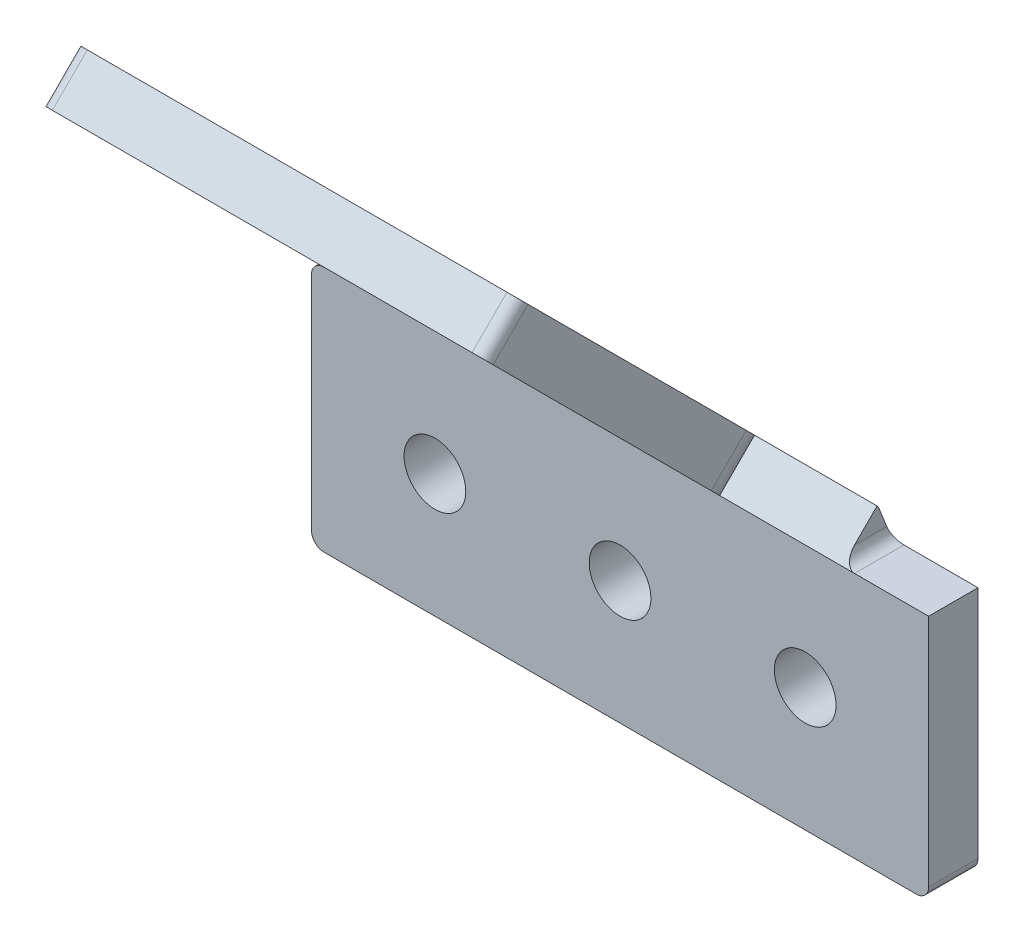
from build123d import *

# Parameters (mm, degrees)
SKETCH_1_W          = 50
SKETCH_1_H          = 20
EXTRUDE_1_DEPTH     = 4
EXTRUDE_2_DEPTH     = 18
SKETCH_5_R          = 1.5
CUT_EXTRUDE_1_DEPTH = 59.543629581
SKETCH_6_W          = 15
SKETCH_6_H          = 12
CUT_EXTRUDE_2_DEPTH = 59.543629581
FILLET_1_R          = 1
FILLET_2_R          = 1
FILLET_3_R          = 1
SKETCH_7_R          = 2.5
CUT_EXTRUDE_3_DEPTH = 2
SKETCH_8_R          = 2.5
CUT_EXTRUDE_4_DEPTH = 57.695644481
SKETCH_9_W          = 10.6
SKETCH_9_H          = 4.503957044
CUT_EXTRUDE_5_DEPTH = 10
FILLET_4_R          = 3


with BuildPart() as part:
    # 草图1 → 凸台-拉伸1 (new body)
    with BuildSketch(Plane.XY):
        Rectangle(SKETCH_1_W, SKETCH_1_H)
    extrude(amount=EXTRUDE_1_DEPTH)

    # 草图4 → 凸台-拉伸2 (add, symmetric)
    with BuildSketch(Plane(origin=(0, 0, 0), x_dir=(0, 0, -1), z_dir=(1, 0, 0))):
        Polygon((-4, 10), (-32.991378029, 38.991378029), (-30.162950904, 41.819805153), (-1.087902103, 12.744756352), (0, 10), align=None)
    extrude(amount=EXTRUDE_2_DEPTH, both=True)

    # 草图5 → 切除-拉伸1 (cut, through all)
    with BuildSketch(Plane(origin=(0, 3, -3), x_dir=(1, 0, 0), z_dir=(0, -0.7071067811865488, 0.7071067811865462))):
        with Locations(Location((12.721590614, 44.887973136, 0), (0, 0, 270))):
            Circle(SKETCH_5_R)
        with Locations(Location((-13.670456314, 14.830364134, 0), (0, 0, 270))):
            Circle(SKETCH_5_R)
    extrude(amount=-CUT_EXTRUDE_1_DEPTH, mode=Mode.SUBTRACT)

    # 草图6 → 切除-拉伸2 (cut, through all)
    with BuildSketch(Plane(origin=(0, 3, -3), x_dir=(1, 0, 0), z_dir=(0, -0.7071067811865488, 0.7071067811865462))):
        with Locations((10.5, 15.899494937)):
            Rectangle(SKETCH_6_W, SKETCH_6_H)
    extrude(amount=-CUT_EXTRUDE_2_DEPTH, mode=Mode.SUBTRACT)

    # 圆角1
    fillet_1_edges = [part.edges().sort_by_distance(p)[0] for p in [
        (3, 11.414213562, 2.585786438),
        (3, 19.899494937, 11.071067812),
    ]]
    fillet(fillet_1_edges, radius=FILLET_1_R)

    # 圆角2
    # the kernel refuses this fillet: 1 mm, written as the material it adds along each edge
    with BuildSketch(Plane(origin=(-18, 10, 0), x_dir=(0, 1, 0), z_dir=(0, 0, 1))) as fillet_2_piece_1_section:
        with BuildLine():
            CenterArc((FILLET_2_R, FILLET_2_R), FILLET_2_R, 180, 90)
            Line((0, FILLET_2_R), (0, 0))
            Line((0, 0), (FILLET_2_R, 0))
        make_face()
    fillet_2_piece_1 = extrude(amount=4, mode=Mode.PRIVATE)
    fillet_2_piece_1 = split(fillet_2_piece_1, bisect_by=Plane(origin=(-18.229103678, 9.132725648, 3.132725648), z_dir=(0, 0.7071067811865489, -0.7071067811865462)), keep=Keep.TOP, mode=Mode.PRIVATE)
    fillet_2_piece_1 = split(fillet_2_piece_1, bisect_by=Plane(origin=(-18.229103678, 10.891700331, 0.353431249), z_dir=(0, -0.36846891223412287, 0.9296400705203075)), keep=Keep.TOP, mode=Mode.PRIVATE)
    add(fillet_2_piece_1)
    with BuildSketch(Plane(origin=(-18, 10, 0), x_dir=(0, 1, 0), z_dir=(0, 0, 1))) as fillet_2_piece_2_section:
        with BuildLine():
            CenterArc((FILLET_2_R, FILLET_2_R), FILLET_2_R, 180, 90)
            Line((0, FILLET_2_R), (0, 0))
            Line((0, 0), (FILLET_2_R, 0))
        make_face()
    fillet_2_piece_2 = extrude(amount=6.5, mode=Mode.PRIVATE)
    fillet_2_piece_2 = split(fillet_2_piece_2, bisect_by=Plane(origin=(-18.106472513, 10.430118052, 4), z_dir=(0, 0, 1)), keep=Keep.TOP, mode=Mode.PRIVATE)
    fillet_2_piece_2 = split(fillet_2_piece_2, bisect_by=Plane(origin=(-18.106472513, 10.322588538, 4.322588538), z_dir=(0, 0.7071067811865489, -0.7071067811865462)), keep=Keep.TOP, mode=Mode.PRIVATE)
    add(fillet_2_piece_2)
    with BuildSketch(Plane(origin=(18, 10, 0), x_dir=(0, 1, 0), z_dir=(0, 0, 1))) as fillet_2_piece_3_section:
        with BuildLine():
            CenterArc((FILLET_2_R, -FILLET_2_R), FILLET_2_R, 90, 90)
            Line((0, -FILLET_2_R), (0, 0))
            Line((0, 0), (FILLET_2_R, 0))
        make_face()
    fillet_2_piece_3 = extrude(amount=4, mode=Mode.PRIVATE)
    fillet_2_piece_3 = split(fillet_2_piece_3, bisect_by=Plane(origin=(18.236725667, 10.843896017, 0.334483697), z_dir=(0, -0.36846891223412287, 0.9296400705203075)), keep=Keep.TOP, mode=Mode.PRIVATE)
    fillet_2_piece_3 = split(fillet_2_piece_3, bisect_by=Plane(origin=(18.236725667, 11.136071068, 2.863928932), z_dir=(0, -0.7071067811865462, -0.7071067811865489)), keep=Keep.TOP, mode=Mode.PRIVATE)
    add(fillet_2_piece_3)
    # the kernel refuses this fillet: 1 mm, written as the material it takes off along each edge
    with BuildSketch(Plane(origin=(-18, 37.223611076, 34.759144982), x_dir=(1, 0, 0), z_dir=(0, 0.7071067811865485, -0.7071067811865467)), Plane(origin=(18, 37.223611076, 34.759144982), x_dir=(0, -0.7071067811865467, -0.7071067811865485), z_dir=(0, 0.7071067811865485, -0.7071067811865467))) as fillet_2_2_piece_1:
        with BuildLine():
            CenterArc((FILLET_2_R, FILLET_2_R), FILLET_2_R, 180, 90)
            Line((0, FILLET_2_R), (0, 0))
            Line((0, 0), (FILLET_2_R, 0))
        make_face()
    extrude(amount=9, mode=Mode.SUBTRACT)
    with BuildSketch(Plane(origin=(-25, 10, -2.5), x_dir=(1, 0, 0), z_dir=(0, 0, 1)), Plane(origin=(25, -10, -2.5), x_dir=(-1, 0, 0), z_dir=(0, 0, 1)), Plane(origin=(-25, -10, -2.5), x_dir=(0, 1, 0), z_dir=(0, 0, 1))) as fillet_2_2_piece_2:
        with BuildLine():
            CenterArc((FILLET_2_R, -FILLET_2_R), FILLET_2_R, 90, 90)
            Line((0, -FILLET_2_R), (0, 0))
            Line((0, 0), (FILLET_2_R, 0))
        make_face()
    extrude(amount=9, mode=Mode.SUBTRACT)

    # 圆角3
    fillet_3_edges = [part.edges().sort_by_distance(p)[0] for p in [
        (0, 12.744756352, 1.087902103),
    ]]
    fillet(fillet_3_edges, radius=FILLET_3_R)

    # 草图7 → 切除-拉伸3 (cut)
    with BuildSketch(Plane(origin=(0, 3, -3), x_dir=(1, 0, 0), z_dir=(0, -0.7071067811865488, 0.7071067811865462))):
        with Locations(Location((12.721590614, 44.887973136, 0), (0, 0, 270))):
            Circle(SKETCH_7_R)
        with Locations(Location((-13.670456314, 14.830364134, 0), (0, 0, 270))):
            Circle(SKETCH_7_R)
    extrude(amount=-CUT_EXTRUDE_3_DEPTH, mode=Mode.SUBTRACT)

    # 草图8 → 切除-拉伸4 (cut, through all)
    with BuildSketch(Plane.XY.offset(4)):
        Circle(SKETCH_8_R)
        with Locations((15, 0)):
            Circle(SKETCH_8_R)
        with Locations((-15, 0)):
            Circle(SKETCH_8_R)
    extrude(amount=-CUT_EXTRUDE_4_DEPTH, mode=Mode.SUBTRACT)

    # 草图9 → 切除-拉伸5 (cut)
    with BuildSketch(Plane(origin=(0, 3, -3), x_dir=(1, 0, 0), z_dir=(0, -0.7071067811865488, 0.7071067811865462))):
        with Locations((-6, 19.119035577)):
            Rectangle(SKETCH_9_W, SKETCH_9_H)
    extrude(amount=-CUT_EXTRUDE_5_DEPTH, mode=Mode.SUBTRACT)

    # 圆角4
    fillet_4_edges = [part.edges().sort_by_distance(p)[0] for p in [
        (18, 19.899494937, 11.071067812),
    ]]
    fillet(fillet_4_edges, radius=FILLET_4_R)


solid = part.part
